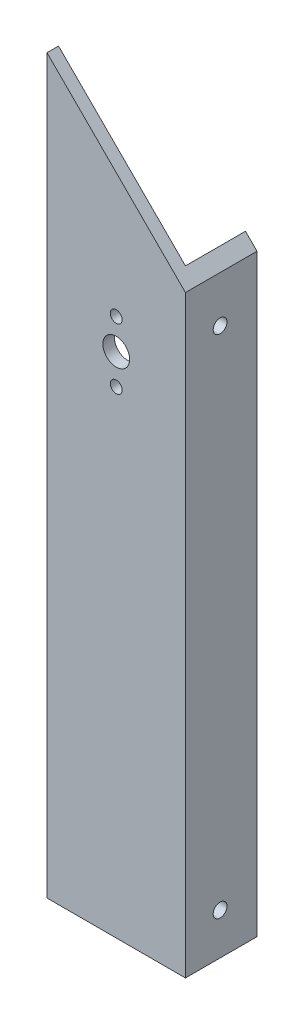
from build123d import *

# Parameters (mm, degrees)
BOSS_EXTRUDE1_DEPTH = 203.2
CUT_EXTRUDE2_DEPTH  = 208.676068012
SKETCH5_R           = 3.683
SKETCH5_R_2         = 1.63195
CUT_EXTRUDE3_DEPTH  = 206.936716758
SKETCH6_R           = 1.89865
CUT_EXTRUDE4_DEPTH  = 206.936716758


with BuildPart() as part:
    # Sketch1 → Boss-Extrude1 (new body)
    with BuildSketch(Plane(origin=(0, 0, 0), x_dir=(1, 0, 0), z_dir=(0, 1, 0))):
        Polygon((0, 0), (-38.1, 0), (-38.1, 3.175), (-3.175, 3.175), (-3.175, 19.685), (0, 19.685), align=None)
    extrude(amount=BOSS_EXTRUDE1_DEPTH)

    # Sketch4 → Cut-Extrude2 (cut, through all)
    with BuildSketch(Plane.XY):
        Polygon((-38.1, 201.422), (-57.250524058, 201.422), (-57.250524058, 247.071987418), (14.491605927, 247.071987418), (14.491605927, 163.322), (0, 163.322), align=None)
    extrude(amount=-CUT_EXTRUDE2_DEPTH, mode=Mode.SUBTRACT)

    # Sketch5 → Cut-Extrude3 (cut, through all)
    with BuildSketch(Plane.XY):
        with Locations((-19.05, 139.7)):
            Circle(SKETCH5_R)
        with Locations((-19.05, 148.082)):
            Circle(SKETCH5_R_2)
        with Locations((-19.05, 131.318)):
            Circle(SKETCH5_R_2)
    extrude(amount=-CUT_EXTRUDE3_DEPTH, mode=Mode.SUBTRACT)

    # Sketch6 → Cut-Extrude4 (cut, through all)
    with BuildSketch(Plane(origin=(0, 0, 0), x_dir=(0, 0, -1), z_dir=(1, 0, 0))):
        with Locations((9.530474513, 11.43)):
            Circle(SKETCH6_R)
        with Locations((9.530474513, 150.622)):
            Circle(SKETCH6_R)
    extrude(amount=-CUT_EXTRUDE4_DEPTH, mode=Mode.SUBTRACT)


solid = part.part
